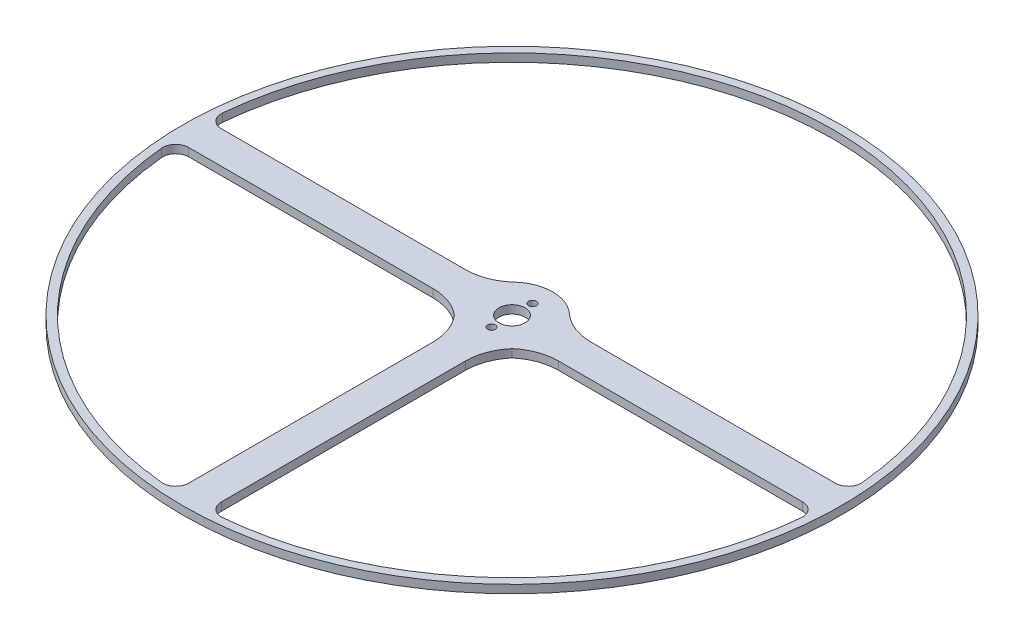
from build123d import *

# Parameters (mm, degrees)
SKETCH4_R           = 128.5748
BOSS_EXTRUDE1_DEPTH = 3.175
CUT_EXTRUDE2_DEPTH  = 182.859943404
SCREW_HOLES_R       = 1.513296856
SCREW_HOLES_R_2     = 5.08
MIDDLE_HOLES_DEPTH  = 182.859943404
FILLETMIDDLE_R      = 20.32
FILLETSIDES_R       = 5.08


with BuildPart() as part:
    # Sketch4 → Boss-Extrude1 (new body)
    with BuildSketch(Plane(origin=(0, 0, 0), x_dir=(1, 0, 0), z_dir=(0, 1, 0))):
        with Locations(Location((0, 0, 0), (0, 0, 270))):
            Circle(SKETCH4_R)
    extrude(amount=BOSS_EXTRUDE1_DEPTH)

    # Sketch1 → Cut-Extrude2 (cut, through all)
    with BuildSketch(Plane(origin=(0, 0, 0), x_dir=(1, 0, 0), z_dir=(0, 1, 0))):
        with BuildLine():
            Line((-14.549677831, 6.35), (-125.238921027, 6.35))
            ThreePointArc((-125.238921027, 6.35), (0, 125.3998), (125.238921027, 6.35))
            Line((125.238921027, 6.35), (14.549677831, 6.35))
            ThreePointArc((14.549677831, 6.35), (0, 15.875), (-14.549677831, 6.35))
        make_face()
        with BuildLine():
            Line((125.238921027, -6.35), (14.549677831, -6.35))
            ThreePointArc((14.549677831, -6.35), (11.225320151, -11.225320151), (6.35, -14.549677831))
            Line((6.35, -14.549677831), (6.35, -125.238921027))
            ThreePointArc((6.35, -125.238921027), (88.671048939, -88.671048939), (125.238921027, -6.35))
        make_face()
        with BuildLine():
            Line((-6.35, -14.549677831), (-6.35, -125.238921027))
            ThreePointArc((-6.35, -125.238921027), (-88.671048939, -88.671048939), (-125.238921027, -6.35))
            Line((-125.238921027, -6.35), (-14.549677831, -6.35))
            ThreePointArc((-14.549677831, -6.35), (-11.225320151, -11.225320151), (-6.35, -14.549677831))
        make_face()
    extrude(amount=CUT_EXTRUDE2_DEPTH, mode=Mode.SUBTRACT)

    # Screw holes → middle holes (cut, through all)
    with BuildSketch(Plane(origin=(0, 0, 0), x_dir=(1, 0, 0), z_dir=(0, 1, 0))):
        with Locations(Location((0, 8, 0), (0, 0, 270))):
            Circle(SCREW_HOLES_R)
        with Locations(Location((0, -8, 0), (0, 0, 270))):
            Circle(SCREW_HOLES_R)
        with Locations(Location((0, 0, 0), (0, 0, 270))):
            Circle(SCREW_HOLES_R_2)
    extrude(amount=MIDDLE_HOLES_DEPTH, mode=Mode.SUBTRACT)

    # Filletmiddle
    # the kernel refuses this fillet: 20.32 mm, written as the material it adds along each edge
    with BuildSketch(Plane(origin=(-14.549677831, 0, -6.35), x_dir=(-1, 0, 0), z_dir=(0, 1, 0)), Plane(origin=(14.549677831, 0, 6.35), x_dir=(1, 0, 0), z_dir=(0, 1, 0)), Plane(origin=(-6.35, 0, 14.549677831), x_dir=(0, 0, 1), z_dir=(0, 1, 0))) as filletmiddle_piece_1:
        with BuildLine():
            CenterArc((9.920490231, -20.32), FILLETMIDDLE_R, 90, 42.536898363)
            ThreePointArc((-3.81714798, -5.347368421), (-1.628915718, -2.873314556), (0, 0))
            Line((0, 0), (9.920490231, 0))
        make_face()
    extrude(amount=3.175)
    with BuildSketch(Plane(origin=(14.549677831, 0, -6.35), x_dir=(1, 0, 0), z_dir=(0, 1, 0)), Plane(origin=(-14.549677831, 0, 6.35), x_dir=(-1, 0, 0), z_dir=(0, 1, 0))) as filletmiddle_piece_2:
        with BuildLine():
            CenterArc((9.920490231, 20.32), FILLETMIDDLE_R, 227.463101637, 42.536898363)
            ThreePointArc((-3.81714798, 5.347368421), (-1.628915718, 2.873314556), (0, 0))
            Line((0, 0), (9.920490231, 0))
        make_face()
    extrude(amount=3.175)
    with BuildSketch(Plane(origin=(6.35, 0, 14.549677831), x_dir=(0.8139062748674819, 0, -0.580996192527403), z_dir=(0, 1, 0))) as filletmiddle_piece_3:
        with BuildLine():
            CenterArc((10.774808453, -19.880191881), FILLETMIDDLE_R, 101.942461579, 42.536898363)
            Line((-5.763767052, -8.074349249), (0, 0))
            ThreePointArc((0, 0), (3.285002577, -0.343600093), (6.570005154, 0))
        make_face()
    extrude(amount=3.175)

    # Filletsides
    filletsides_edges = [part.edges().sort_by_distance(p)[0] for p in [
        (125.238921027, 1.5875, -6.35),
        (-125.238921027, 1.5875, -6.35),
        (6.35, 1.5875, 125.238921027),
        (125.238921027, 1.5875, 6.35),
        (-125.238921027, 1.5875, 6.35),
        (-6.35, 1.5875, 125.238921027),
    ]]
    fillet(filletsides_edges, radius=FILLETSIDES_R)


solid = part.part
